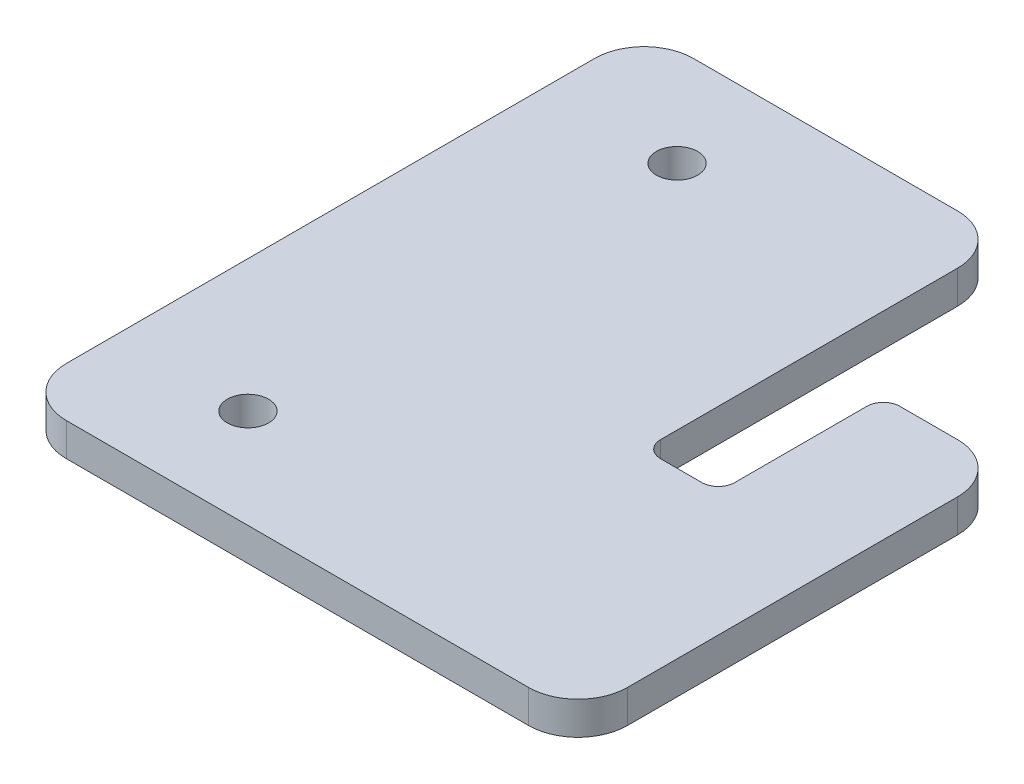
from build123d import *

# Parameters (mm, degrees)
SKETCH1_W                   = 34
SKETCH1_H                   = 38
BASE_FLANGE1_DEPTH          = 2
TAP_DRILL_FOR_M3X0_5_TAP1_D = 2.5
CUT_EXTRUDE1_DEPTH          = 10
CUT_EXTRUDE1_DEPTH_BACK     = 10
FILLET2_R                   = 1
FILLET1_R                   = 3


# Sheet-metal steps are written as plain solids
with BuildPart() as part:
    # Sketch1 → Base-Flange1 (new body)
    with BuildSketch(Plane(origin=(0, 0, 0), x_dir=(1, 0, 0), z_dir=(0, 1, 0))):
        Rectangle(SKETCH1_W, SKETCH1_H)
    extrude(amount=-BASE_FLANGE1_DEPTH)

    # Tap Drill for M3x0.5 Tap1 (through all)
    with Locations(Plane(origin=(0, 0, 0), x_dir=(1, 0, 0), z_dir=(0, 1, 0))):
        with Locations((-9, -13), (-9, 13)):
            Hole(TAP_DRILL_FOR_M3X0_5_TAP1_D / 2)

    # Sketch14 → Cut-Extrude1 (cut, two sides: drawn at the far end of the back side and taken through both)
    with BuildSketch(Plane(origin=(0, -2, 0), x_dir=(-1, 0, 0), z_dir=(0, -1, 0)).offset(-CUT_EXTRUDE1_DEPTH_BACK)):
        Polygon((-9.5, 19), (-5, 19), (-5, -3), (-9.5, -3), (-9.5, 7), (-26.223726354, 7), (-26.223726354, 19), align=None)
    extrude(amount=CUT_EXTRUDE1_DEPTH + CUT_EXTRUDE1_DEPTH_BACK, mode=Mode.SUBTRACT)

    # Fillet2
    fillet2_edges = [part.edges().sort_by_distance(p)[0] for p in [
        (9.5, -1, -7),
        (9.5, -1, 3),
        (5, -1, 3),
    ]]
    fillet(fillet2_edges, radius=FILLET2_R)

    # Fillet1
    fillet1_edges = [part.edges().sort_by_distance(p)[0] for p in [
        (5, -1, -19),
        (17, -1, -7),
        (-17, -1, -19),
        (17, -1, 19),
        (-17, -1, 19),
    ]]
    fillet(fillet1_edges, radius=FILLET1_R)


solid = part.part
